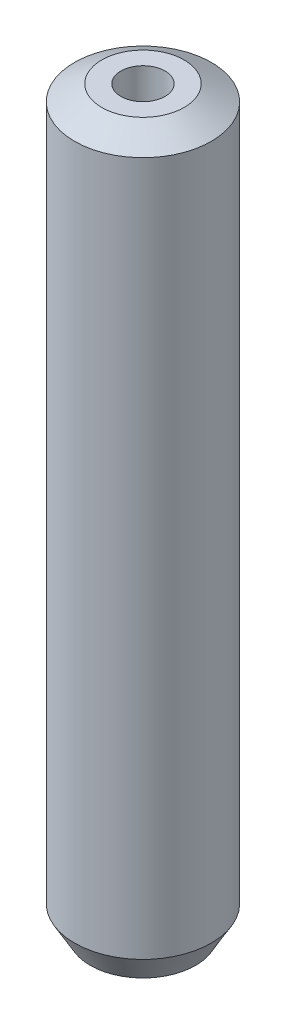
from build123d import *
from OCP.BRepFilletAPI import BRepFilletAPI_MakeChamfer

# Parameters (mm, degrees)
SKETCH1_R           = 5
BOSS_EXTRUDE1_DEPTH = 53.889661241
SKETCH2_R           = 1.613503242
CUT_EXTRUDE1_DEPTH  = 55.351592328
CHAMFER1_SIZE       = 1.148241963
CHAMFER1_SIZE2      = 1.988813419


with BuildPart() as part:
    # Sketch1 → Boss-Extrude1 (new body)
    with BuildSketch(Plane(origin=(0, 0, 0), x_dir=(1, 0, 0), z_dir=(0, 1, 0))):
        Circle(SKETCH1_R)
    extrude(amount=BOSS_EXTRUDE1_DEPTH)

    # Sketch2 → Cut-Extrude1 (cut, through all)
    with BuildSketch(Plane(origin=(0, 0, 0), x_dir=(1, 0, 0), z_dir=(0, 1, 0))):
        Circle(SKETCH2_R)
    extrude(amount=CUT_EXTRUDE1_DEPTH, mode=Mode.SUBTRACT)

    # Chamfer1: one chamfer whose edges measure the first distance from different faces: ONE call of the kernel's chamfer builder (chamfer() names one face for all edges)
    chamfer1_edges_1 = [part.edges().sort_by_distance(p)[0] for p in [
        (-5, 53.889661241, 0),
    ]]
    chamfer1_side_1 = [part.faces().sort_by_distance(p)[0] for p in [
        (-5, 26.94483062, 0),
    ]]
    chamfer1_edges_2 = [part.edges().sort_by_distance(p)[0] for p in [
        (-5, 0, 0),
    ]]
    chamfer1_side_2 = [part.faces().sort_by_distance(p)[0] for p in [
        (-4.858578644, 0, 0),
    ]]
    chamfer1 = BRepFilletAPI_MakeChamfer(part.part.solid().wrapped)
    for e in chamfer1_edges_1:
        chamfer1.Add(CHAMFER1_SIZE, CHAMFER1_SIZE2, e.wrapped, chamfer1_side_1[0].wrapped)  # the first distance lies on this face
    for e in chamfer1_edges_2:
        chamfer1.Add(CHAMFER1_SIZE, CHAMFER1_SIZE2, e.wrapped, chamfer1_side_2[0].wrapped)  # the first distance lies on this face
    add(Compound.cast(chamfer1.Shape()), mode=Mode.REPLACE)


solid = part.part
